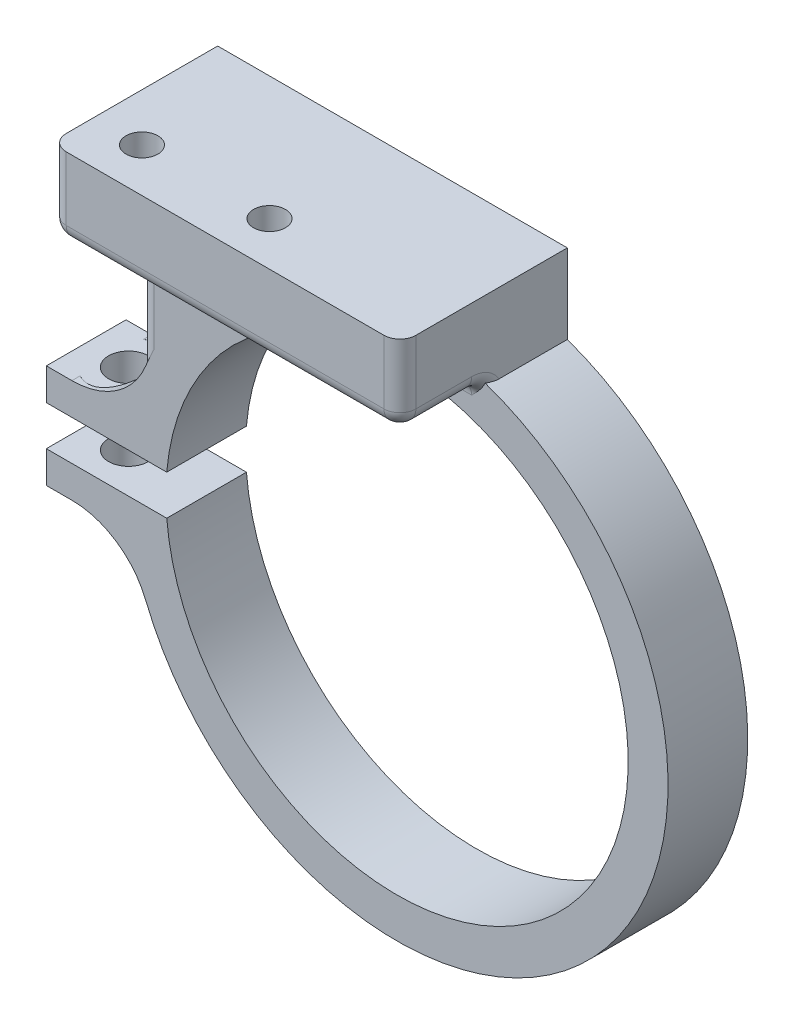
from build123d import *

# Parameters (mm, degrees)
BOSS_EXTRUDE3_DEPTH     = 10
SKETCH3_W               = 43.8640004
SKETCH3_H               = 10
BOSS_EXTRUDE4_DEPTH     = 21
SKETCH4_R               = 2
CUT_EXTRUDE1_DEPTH      = 83.054859698
SKETCH5_R               = 3.5
CUT_EXTRUDE2_DEPTH      = 4
FILLET1_R               = 2
FILLET2_R               = 2
FILLET3_R               = 2
FILLET4_R               = 2
CUT_EXTRUDE3_DEPTH      = 69.769542741
CUT_EXTRUDE3_DEPTH_BACK = 69.769542741
SKETCH6_R               = 2.5
FILLET5_R               = 10
FILLET6_R               = 10
SKETCH7_R               = 4.5
CUT_EXTRUDE4_DEPTH      = 10
CUT_EXTRUDE5_START      = 10
SKETCH8_R               = 4.5
CUT_EXTRUDE5_DEPTH      = 10


# Some blends are built 0.0001 mm under size
with BuildPart() as part:
    # Sketch2 → Boss-Extrude3 (new body)
    with BuildSketch(Plane.XY):
        with BuildLine():
            Line((-44, -2.5), (-44, -6.5))
            Line((-44, -6.5), (-33.372893192, -6.5))
            ThreePointArc((-33.372893192, -6.5), (22.19279887, -25.758099276), (11.3640004, 32.04464846))
            Line((11.3640004, 32.04464846), (11.3640004, 42))
            Line((11.3640004, 42), (-32.5, 42))
            Line((-32.5, 42), (-32.5, 9.987492178))
            ThreePointArc((-32.5, 9.987492178), (-32.982573653, 8.255291346), (-33.372893192, 6.5))
            Line((-33.372893192, 6.5), (-44, 6.5))
            Line((-44, 6.5), (-44, 2.5))
            Line((-44, 2.5), (-28.892040426, 2.5))
            ThreePointArc((-28.892040426, 2.5), (29, 0), (-28.892040426, -2.5))
            Line((-28.892040426, -2.5), (-44, -2.5))
        make_face()
    extrude(amount=BOSS_EXTRUDE3_DEPTH)

    # Sketch3 → Boss-Extrude4 (add)
    with BuildSketch(Plane(origin=(0, 0, 0), x_dir=(-1, 0, 0), z_dir=(0, 0, -1))):
        with Locations((10.5679998, 37)):
            Rectangle(SKETCH3_W, SKETCH3_H)
    extrude(amount=-BOSS_EXTRUDE4_DEPTH)

    # Sketch4 → Cut-Extrude1 (cut, through all)
    with BuildSketch(Plane.XZ.offset(-32)):
        with Locations(Location((-26.5, 15.5, 0), (0, 0, 270))):
            Circle(SKETCH4_R)
        with Locations(Location((-10.5, 15.5, 0), (0, 0, 270))):
            Circle(SKETCH4_R)
    extrude(amount=-CUT_EXTRUDE1_DEPTH, mode=Mode.SUBTRACT)

    # Sketch5 → Cut-Extrude2 (cut)
    with BuildSketch(Plane.XZ.offset(-32)):
        with Locations(Location((-26.5, 15.5, 0), (0, 0, 270))):
            Circle(SKETCH5_R)
        with Locations(Location((-10.5, 15.5, 0), (0, 0, 270))):
            Circle(SKETCH5_R)
    extrude(amount=-CUT_EXTRUDE2_DEPTH, mode=Mode.SUBTRACT)

    # Fillet1
    fillet1_edges = [part.edges().sort_by_distance(p)[0] for p in [
        (-10.5679998, 32, 10),
    ]]
    fillet(fillet1_edges, radius=FILLET1_R - 0.0001)  # a hair under: the kernel refuses the full size

    # Fillet2
    # the kernel refuses this fillet: 2 mm, written as the material it takes off along each edge
    with BuildSketch(Plane(origin=(11.3640004, 30.0001, 11.9999), x_dir=(0, -0.597567009658115, 0.8018189751859569), z_dir=(0, 0.8018189751859569, 0.597567009658115))) as fillet2_piece_1_section:
        with BuildLine():
            CenterArc((1.9999 + FILLET2_R, -FILLET2_R), FILLET2_R, 90, 90)
            Line((1.9999 + FILLET2_R, 0), (1.9999, 0))
            Line((1.9999, 0), (1.9999, -FILLET2_R))
        make_face()
    fillet2_piece_1 = revolve(axis=Axis((11.3640004, 30.0001, 11.9999), (1, 0, 0)), revolution_arc=233.304154445, mode=Mode.PRIVATE)
    fillet2_piece_1 = split(fillet2_piece_1, bisect_by=Plane(origin=(10.740737353, 31.499904871, 10), z_dir=(0, 0, 1)), keep=Keep.TOP, mode=Mode.PRIVATE)
    add(fillet2_piece_1, mode=Mode.SUBTRACT)
    with BuildSketch(Plane(origin=(11.3640004, 30.0001, 11.9999), x_dir=(0, -0.597567009658115, 0.8018189751859569), z_dir=(0, 0.8018189751859569, 0.597567009658115))) as fillet2_piece_2_section:
        with BuildLine():
            CenterArc((1.9999 + FILLET2_R, -FILLET2_R), FILLET2_R, 90, 90)
            Line((1.9999 + FILLET2_R, 0), (1.9999, 0))
            Line((1.9999, 0), (1.9999, -FILLET2_R))
        make_face()
    fillet2_piece_2 = revolve(axis=Axis((11.3640004, 30.0001, 11.9999), (1, 0, 0)), revolution_arc=233.304154445, mode=Mode.PRIVATE)
    fillet2_piece_2 = fillet2_piece_2 - Plane(origin=(0, 0, 9.683888081), x_dir=(-0.9815556821156025, -0.19117647058823523, 0), z_dir=(0, 0, -1)) * Cylinder(34, 16, mode=Mode.PRIVATE)
    add(fillet2_piece_2, mode=Mode.SUBTRACT)
    with BuildSketch(Plane(origin=(11.3640004, 32, 11.9999), x_dir=(-1, 0, 0), z_dir=(0, 0, 1))) as fillet2_piece_3:
        with BuildLine():
            CenterArc((FILLET2_R, -FILLET2_R), FILLET2_R, 90, 90)
            Line((0, -FILLET2_R), (0, 0))
            Line((0, 0), (FILLET2_R, 0))
        make_face()
    extrude(amount=14.0001, mode=Mode.SUBTRACT)

    # Fillet3
    fillet3_edges = [part.edges().sort_by_distance(p)[0] for p in [
        (-32.5, 31.414242852, 10.585757148),
        (-32.5, 19.993796089, 10),
        (-32.5, 32, 16.49995),
    ]]
    fillet(fillet3_edges, radius=FILLET3_R)

    # Fillet4
    fillet4_edges = [part.edges().sort_by_distance(p)[0] for p in [
        (-10.5679998, 32, 21),
        (10.778213962, 32.585786438, 21),
        (-32.5, 38, 21),
        (-31.914213562, 32.585786438, 21),
        (11.3640004, 38, 21),
    ]]
    fillet(fillet4_edges, radius=FILLET4_R - 0.0001)  # a hair under: the kernel refuses the full size

    # Sketch6 → Cut-Extrude3 (cut, two sides: drawn at the far end of the back side and taken through both)
    with BuildSketch(Plane.XZ.offset(6.5).offset(-CUT_EXTRUDE3_DEPTH_BACK)):
        with Locations(Location((-38.686446596, 5, 0), (0, 0, 270))):
            Circle(SKETCH6_R)
    extrude(amount=CUT_EXTRUDE3_DEPTH + CUT_EXTRUDE3_DEPTH_BACK, mode=Mode.SUBTRACT)

    # Fillet5
    # the kernel refuses this fillet: 10 mm, written as the material it adds along each edge
    with BuildSketch(Plane(origin=(-33.372893192, -6.5, 0), x_dir=(0.28439822949725985, -0.9587062360592132, 0), z_dir=(0, 0, 1))) as fillet5_piece_1_section:
        with BuildLine():
            CenterArc((7.477908641, -9.953938032), FILLET5_R, 95.501431601, 67.975687163)
            Line((-2.109153719, -7.109955737), (0, 0))
            ThreePointArc((0, 0), (3.259601203, -0.15661069), (6.519202405, 0))
        make_face()
    fillet5_piece_1 = extrude(amount=10, mode=Mode.PRIVATE)
    fillet5_piece_1 = fillet5_piece_1 - Plane(origin=(-38.686446596, -7.980864668, 5), x_dir=(0, 0, -1), z_dir=(0, -1, 0)) * Cylinder(2.5, 49, mode=Mode.PRIVATE)
    add(fillet5_piece_1)

    # Fillet6
    # the kernel refuses this fillet: 10 mm, written as the material it adds along each edge
    with BuildSketch(Plane(origin=(-33.372893192, 6.5, 0), x_dir=(0.28439822949726035, 0.9587062360592132, 0), z_dir=(0, 0, 1))) as fillet6_piece_1_section:
        with BuildLine():
            CenterArc((7.477908641, 9.953938032), FILLET6_R, 196.522881236, 67.975687163)
            Line((-2.109153719, 7.109955737), (0, 0))
            ThreePointArc((0, 0), (3.259601203, 0.15661069), (6.519202405, 0))
        make_face()
    fillet6_piece_1 = extrude(amount=10, mode=Mode.PRIVATE)
    fillet6_piece_1 = fillet6_piece_1 - Plane(origin=(-38.686446596, 7.980864668, 5), x_dir=(0, 0, -1), z_dir=(0, -1, 0)) * Cylinder(2.5, 49, mode=Mode.PRIVATE)
    add(fillet6_piece_1)

    # Sketch7 → Cut-Extrude4 (cut)
    with BuildSketch(Plane.XZ.offset(6.5)):
        with Locations((-38.686446596, 5)):
            Circle(SKETCH7_R)
    extrude(amount=CUT_EXTRUDE4_DEPTH, mode=Mode.SUBTRACT)

    # Sketch8 → Cut-Extrude5 (cut)
    with BuildSketch(Plane(origin=(0, 6.5, 0), x_dir=(1, 0, 0), z_dir=(0, 1, 0)).offset(CUT_EXTRUDE5_START)):
        with Locations((-38.686446596, -5)):
            Circle(SKETCH8_R)
    extrude(amount=-CUT_EXTRUDE5_DEPTH, mode=Mode.SUBTRACT)


solid = part.part
